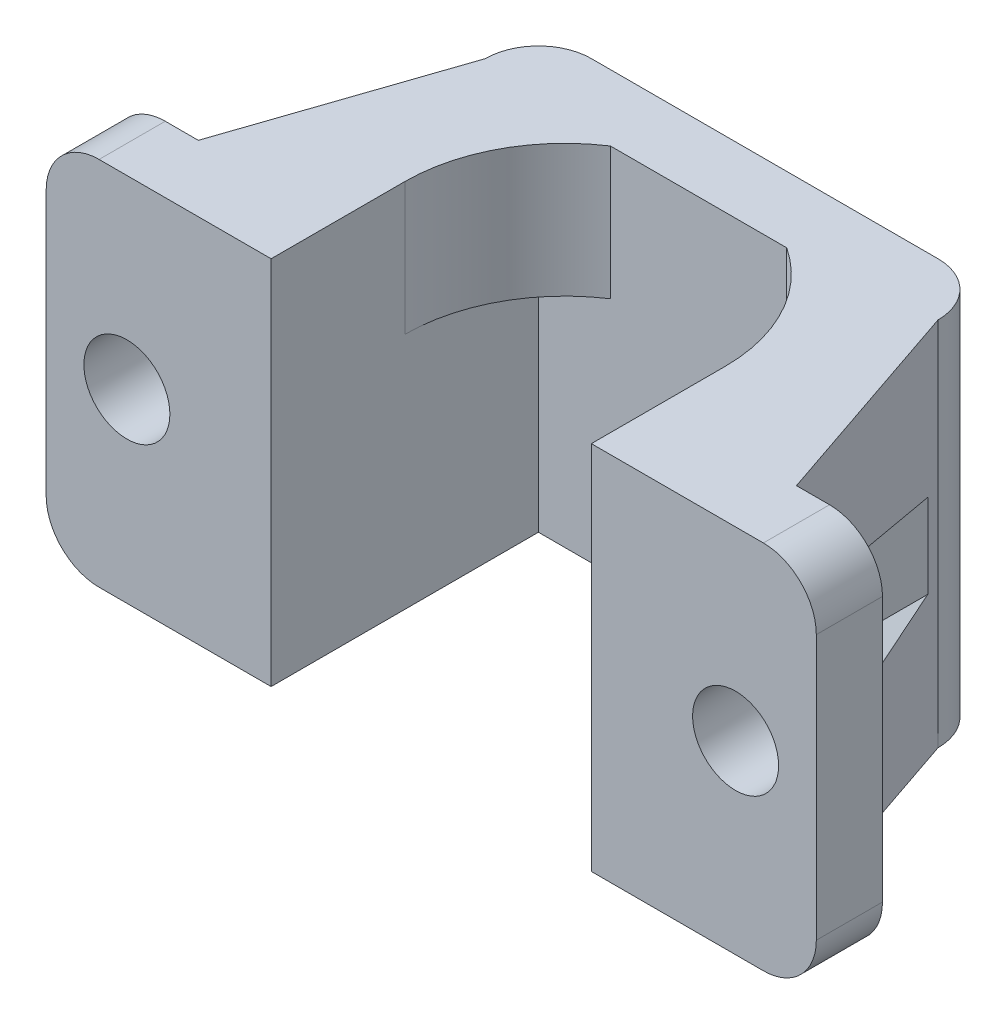
from build123d import *

# Parameters (mm, degrees)
CUERPO_BASE_DEPTH          = 14
CROQUIS2_R                 = 1.625
AGUJEROS_DE_SUJECION_DEPTH = 14
TUERCAS_START              = -2.5
TUERCAS_DEPTH              = 22.300472684
REDONDEO_BORDES_R          = 2
SALIENTE_EXTRUIR2_DEPTH    = 5


with BuildPart() as part:
    # Croquis1 → Cuerpo Base (new body)
    with BuildSketch(Plane(origin=(0, 0, 0), x_dir=(1, 0, 0), z_dir=(0, 1, 0))):
        Polygon((-14.55, 0), (-6.05, 0), (-6.05, 10.1), (0, 10.1), (0, 12.6), (-8.55, 12.6), (-8.55, 10.6), (-8.55, 2.5), (-11.3, 2.5), (-14.55, 2.5), align=None)
        Polygon((-8.55, 10.6), (-11.3, 2.5), (-8.55, 2.5), align=None)
        Polygon((0, 12.6), (0, 10.1), (6.05, 10.1), (6.05, 0), (14.55, 0), (14.55, 2.5), (11.3, 2.5), (8.55, 2.5), (8.55, 10.6), (8.55, 12.6), align=None)
        Polygon((11.3, 2.5), (8.55, 10.6), (8.55, 2.5), align=None)
    extrude(amount=CUERPO_BASE_DEPTH)

    # Croquis2 → Agujeros de sujecion (cut)
    with BuildSketch(Plane.XY):
        with Locations((-11.5, 7)):
            Circle(CROQUIS2_R)
        with Locations(Location((11.5, 7, 0), (0, 0, 97.069714042))):
            Circle(CROQUIS2_R)
    extrude(amount=-AGUJEROS_DE_SUJECION_DEPTH, mode=Mode.SUBTRACT)

    # Croquis3 → Tuercas (cut, through all)
    with BuildSketch(Plane.XY.offset(TUERCAS_START)):
        Polygon((-14.25, 5.41228676), (-11.5, 3.824573519), (-8.75, 5.41228676), (-8.75, 8.58771324), (-11.5, 10.175426481), (-14.25, 8.58771324), align=None)
        Polygon((11.5, 3.824573519), (14.25, 5.41228676), (14.25, 8.58771324), (11.5, 10.175426481), (8.75, 8.58771324), (8.75, 5.41228676), align=None)
    extrude(amount=-TUERCAS_DEPTH, mode=Mode.SUBTRACT)

    # Redondeo bordes
    redondeo_bordes_edges = [part.edges().sort_by_distance(p)[0] for p in [
        (-8.55, 7, -12.6),
        (8.55, 7, -12.6),
        (14.55, 0, -1.25),
        (14.55, 14, -1.25),
        (-14.55, 0, -1.25),
        (-14.55, 14, -1.25),
    ]]
    fillet(redondeo_bordes_edges, radius=REDONDEO_BORDES_R - 0.0001)  # a hair under: the kernel refuses the full size

    # Croquis4 → Saliente-Extruir2 (add)
    with BuildSketch(Plane(origin=(0, 14, 0), x_dir=(1, 0, 0), z_dir=(0, 1, 0))):
        with BuildLine():
            Line((-3.33166625, 10.1), (-6.05, 10.1))
            Line((-6.05, 10.1), (-6.05, 5.05))
            ThreePointArc((-6.05, 5.05), (-5.327245105, 7.917570329), (-3.33166625, 10.1))
        make_face()
        with BuildLine():
            Line((6.05, 10.1), (3.33166625, 10.1))
            ThreePointArc((3.33166625, 10.1), (5.327245105, 7.917570329), (6.05, 5.05))
            Line((6.05, 5.05), (6.05, 10.1))
        make_face()
    extrude(amount=-SALIENTE_EXTRUIR2_DEPTH)


solid = part.part
